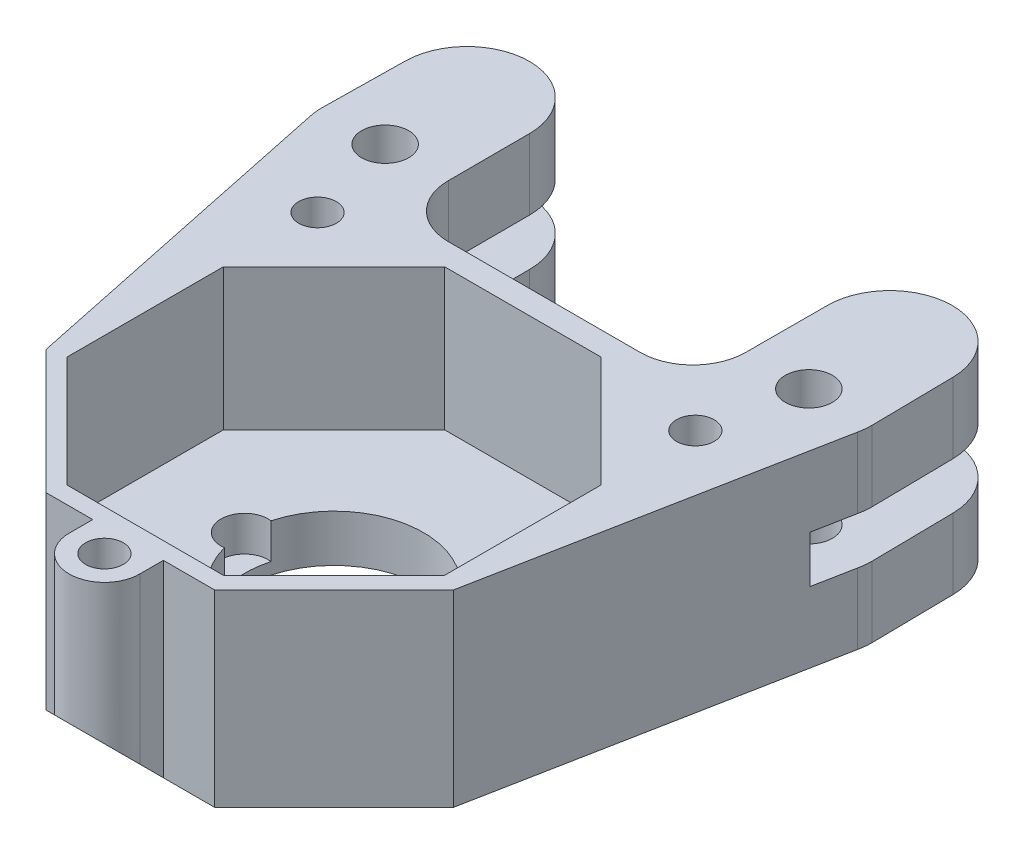
from build123d import *

# Parameters (mm, degrees)
SKETCH1_R            = 7.6
SKETCH1_R_2          = 2
BOSS_EXTRUDE2_DEPTH  = 16
CUT_EXTRUDE1_DEPTH   = 12
SKETCH3_R            = 2
CUT_EXTRUDE2_DEPTH   = 3
SKETCH4_W            = 19.148912363
SKETCH4_H            = 4
SKETCH4_W_2          = 1.506114963
SKETCH4_H_2          = 2
SKETCH4_W_3          = 17.088400717
CUT_EXTRUDE3_DEPTH   = 34
SKETCH5_R            = 1.6
CUT_EXTRUDE4_DEPTH   = 8
SKETCH6_R            = 1.6
BOSS_EXTRUDE4_DEPTH  = 7
BOSS_EXTRUDE7_START  = -1
SKETCH9_R            = 1.6
BOSS_EXTRUDE7_DEPTH  = 1
CHAMFER2_START       = 5.004712753
CHAMFER2_DEPTH       = 3.995287247
CHAMFER2_2_DEPTH     = 5.004712753
CHAMFER2_START_2     = -28.681393589
CHAMFER2_3_OUTLINE_W = 6
CHAMFER2_3_OUTLINE_H = 10
CHAMFER2_3_DEPTH     = 3.538866325


with BuildPart() as part:
    # Sketch1 → Boss-Extrude2 (new body)
    with BuildSketch(Plane(origin=(0, 0, 0), x_dir=(1, 0, 0), z_dir=(0, 1, 0))):
        with BuildLine():
            Line((-6.773390856, -35.556903049), (7.560970701, -35.556903049))
            Line((7.560970701, -35.556903049), (17.696894961, -25.420978788))
            Line((17.696894961, -25.420978788), (23.251588719, 3.383405224))
            ThreePointArc((23.251588719, 3.383405224), (23.336919229, 3.930241848), (23.365463973, 4.482959485))
            Line((23.365463973, 4.482959485), (23.363235853, 4.637571356))
            Line((23.363235853, 4.637571356), (23.264685107, 11.476123671))
            ThreePointArc((23.264685107, 11.476123671), (21.66723092, 15.195624527), (17.911941271, 16.707029882))
            ThreePointArc((17.911941271, 16.707029882), (14.188498301, 15.136475123), (12.650070184, 11.399643748))
            Line((12.650070184, 11.399643748), (12.634536027, 4.482959485))
            ThreePointArc((12.634536027, 4.482959485), (11.321507594, 1.313028433), (8.151576542, 0))
            Line((8.151576542, 0), (7.167180778, 0))
            Line((7.167180778, 0), (0, 0))
            Line((0, 0), (-7.167180778, 0))
            Line((-7.167180778, 0), (-8.151576542, 0))
            ThreePointArc((-8.151576542, 0), (-11.321507594, 1.313028433), (-12.634536027, 4.482959485))
            Line((-12.634536027, 4.482959485), (-12.650070184, 11.399643748))
            ThreePointArc((-12.650070184, 11.399643748), (-14.188498301, 15.136475123), (-17.911941271, 16.707029882))
            ThreePointArc((-17.911941271, 16.707029882), (-21.66723092, 15.195624527), (-23.264685107, 11.476123671))
            Line((-23.264685107, 11.476123671), (-23.363235853, 4.637571356))
            Line((-23.363235853, 4.637571356), (-23.365463973, 4.482959485))
            ThreePointArc((-23.365463973, 4.482959485), (-23.336919229, 3.930241848), (-23.251588719, 3.383405224))
            Line((-23.251588719, 3.383405224), (-17.303105039, -25.027188866))
            Line((-17.303105039, -25.027188866), (-6.773390856, -35.556903049))
        make_face()
        with Locations(Location((0.196894961, -18.056903049, 0), (0, 0, 270))):
            Circle(SKETCH1_R, mode=Mode.SUBTRACT)
        with Locations(Location((-18, 4.482959485, 0), (0, 0, 270))):
            Circle(SKETCH1_R_2, mode=Mode.SUBTRACT)
        with Locations(Location((18, 4.482959485, 0), (0, 0, 270))):
            Circle(SKETCH1_R_2, mode=Mode.SUBTRACT)
    extrude(amount=BOSS_EXTRUDE2_DEPTH)

    # Sketch2 → Cut-Extrude1 (cut)
    with BuildSketch(Plane(origin=(0, 16, 0), x_dir=(1, 0, 0), z_dir=(0, 1, 0))):
        Polygon((-6.451232715, -34.106903049), (6.845022637, -34.106903049), (16.246894961, -24.705030725), (16.246894961, -11.408775373), (6.845022637, -2.006903049), (-6.451232715, -2.006903049), (-15.853105039, -11.408775373), (-15.853105039, -24.705030725), align=None)
    extrude(amount=-CUT_EXTRUDE1_DEPTH, mode=Mode.SUBTRACT)

    # Sketch3 → Cut-Extrude2 (cut)
    with BuildSketch(Plane(origin=(0, 4, 0), x_dir=(1, 0, 0), z_dir=(0, 1, 0))):
        with Locations((7.796894961, -18.056903049)):
            Circle(SKETCH3_R)
        with Locations((-7.403105039, -18.056903049)):
            Circle(SKETCH3_R)
    extrude(amount=-CUT_EXTRUDE2_DEPTH, mode=Mode.SUBTRACT)

    # Sketch4 → Cut-Extrude3 (cut)
    with BuildSketch(Plane(origin=(0, 0, 0), x_dir=(-1, 0, 0), z_dir=(0, 0, -1))):
        with Locations((17.726032724, 8)):
            Rectangle(SKETCH4_W, SKETCH4_H)
        Polygon((8.151576542, 10), (1.506114963, 10), (1.506114963, 8), (1.506114963, 6), (8.151576542, 6), align=None)
        Polygon((0, 8), (0, 10), (-8.151576542, 10), (-8.151576542, 6), (0, 6), align=None)
        with Locations((0.753057482, 9)):
            Rectangle(SKETCH4_W_2, SKETCH4_H_2)
        with Locations((0.753057482, 7)):
            Rectangle(SKETCH4_W_2, SKETCH4_H_2)
        with Locations((-16.695776901, 8)):
            Rectangle(SKETCH4_W_3, SKETCH4_H)
    extrude(amount=CUT_EXTRUDE3_DEPTH, mode=Mode.SUBTRACT)

    # Sketch5 → Cut-Extrude4 (cut)
    with BuildSketch(Plane(origin=(0, 16, 0), x_dir=(1, 0, 0), z_dir=(0, 1, 0))):
        with Locations(Location((16.246894961, -3.408775373, 0), (0, 0, 270))):
            Circle(SKETCH5_R)
        with Locations(Location((-15.853105039, -3.408775373, 0), (0, 0, 270))):
            Circle(SKETCH5_R)
    extrude(amount=-CUT_EXTRUDE4_DEPTH, mode=Mode.SUBTRACT)

    # Sketch6 → Boss-Extrude4 (add)
    with BuildSketch(Plane(origin=(0, 16, 0), x_dir=(1, 0, 0), z_dir=(0, 1, 0))):
        with BuildLine():
            Line((3.196894961, -35.556903049), (-2.803105039, -35.556903049))
            Line((-2.803105039, -35.556903049), (-2.803105039, -37.561615802))
            ThreePointArc((-2.803105039, -37.561615802), (0.196894961, -40.561615802), (3.196894961, -37.561615802))
            Line((3.196894961, -37.561615802), (3.196894961, -35.556903049))
        make_face()
        with Locations(Location((0.196894961, -37.561615802, 0), (0, 0, 270))):
            Circle(SKETCH6_R, mode=Mode.SUBTRACT)
    extrude(amount=-BOSS_EXTRUDE4_DEPTH)

    # Sketch9 → Boss-Extrude7 (add)
    with BuildSketch(Plane.XZ.offset(-9).offset(BOSS_EXTRUDE7_START)):
        with Locations(Location((0.196894961, 37.561615802, 0), (0, 0, 90))):
            Circle(SKETCH9_R)
    extrude(amount=BOSS_EXTRUDE7_DEPTH)

    # Chamfer2: read off the stored shape, not the designer's step
    # Chamfer2 outline → Chamfer2 (add)
    with BuildSketch(Plane(origin=(0, 0, 0), x_dir=(1, 0, 0), z_dir=(0, 1, 0)).offset(CHAMFER2_START)):
        with BuildLine():
            ThreePointArc((-2.803105039, -37.561615802), (0.196894961, -40.561615802), (3.196894961, -37.561615802))
            Line((3.196894961, -37.561615802), (3.196894961, -35.556903049))
            Line((3.196894961, -35.556903049), (-2.803105039, -35.556903049))
            Line((-2.803105039, -35.556903049), (-2.803105039, -37.561615802))
        make_face()
    extrude(amount=CHAMFER2_DEPTH)

    # Chamfer2 2 outline → Chamfer2 2 (add)
    with BuildSketch(Plane(origin=(0, 0, 0), x_dir=(1, 0, 0), z_dir=(0, 1, 0))):
        with BuildLine():
            ThreePointArc((-2.803105039, -37.561615802), (0.196894961, -40.561615802), (3.196894961, -37.561615802))
            Line((3.196894961, -37.561615802), (3.196894961, -35.556903049))
            Line((3.196894961, -35.556903049), (-2.803105039, -35.556903049))
            Line((-2.803105039, -35.556903049), (-2.803105039, -37.561615802))
        make_face()
    extrude(amount=CHAMFER2_2_DEPTH)

    # Chamfer2 3 outline → Chamfer2 3 (cut)
    with BuildSketch(Plane(origin=(0, 0, 0), x_dir=(1, 0, 0), z_dir=(0, 0.7071067811865511, -0.7071067811865441)).offset(CHAMFER2_START_2)):
        with Locations((0.196894961, -29)):
            Rectangle(CHAMFER2_3_OUTLINE_W, CHAMFER2_3_OUTLINE_H)
    extrude(amount=CHAMFER2_3_DEPTH, mode=Mode.SUBTRACT)


solid = part.part
